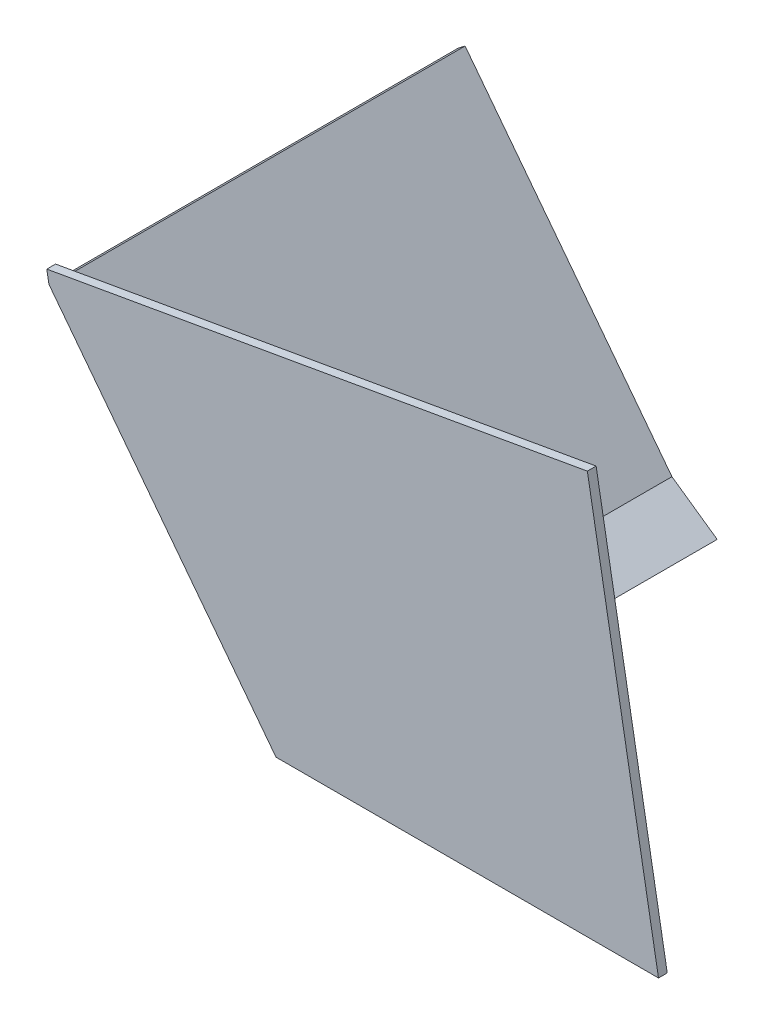
from build123d import *

# Parameters (mm, degrees)
BOSS_EXTRUDE1_DEPTH = 290
BOSS_EXTRUDE2_DEPTH = 6.35


with BuildPart() as part:
    # Sketch1 → Boss-Extrude1 (new body)
    with BuildSketch(Plane.XY):
        Polygon((-156.104827171, 22.943057454), (-305.909392977, 218.17216858), (-310.947186688, 214.306533506), (-146.503999829, 0), (-123.3387454, 0), align=None)
    extrude(amount=BOSS_EXTRUDE1_DEPTH)

    # Sketch2 → Boss-Extrude2 (add)
    with BuildSketch(Plane.XY.offset(290)):
        Polygon((-146.503999829, 0), (-310.947186688, 214.306533506), (-312.502006765, 223.124356339), (78.981463606, 292.153454666), (130.496000171, 0), align=None)
    extrude(amount=BOSS_EXTRUDE2_DEPTH)


solid = part.part
